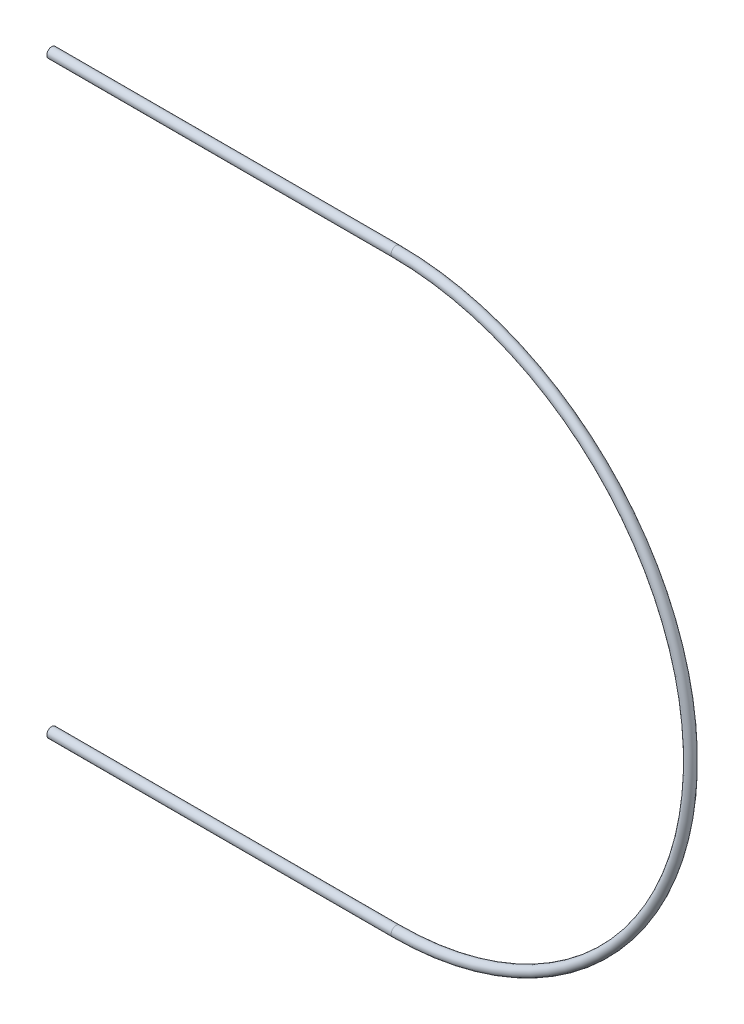
from build123d import *

# Parameters (mm, degrees)
SWEEP1_PROFILE_R = 6


with BuildPart() as part:
    # Sweep1: sweep along a path in Sketch1
    with BuildLine(Plane.XY) as sweep1_path:
        Line((-420, 359), (0, 359))
        ThreePointArc((0, 359), (359, 0), (0, -359))
        Line((0, -359), (-420, -359))
    # Sweep1 profile (on start of the path) → Sweep1 (sweep)
    with BuildSketch(Plane(origin=(-420, 359, 0), x_dir=(0, 0, 1), z_dir=(1, 0, 0))):
        Circle(SWEEP1_PROFILE_R)
    sweep(path=sweep1_path.line)


solid = part.part
